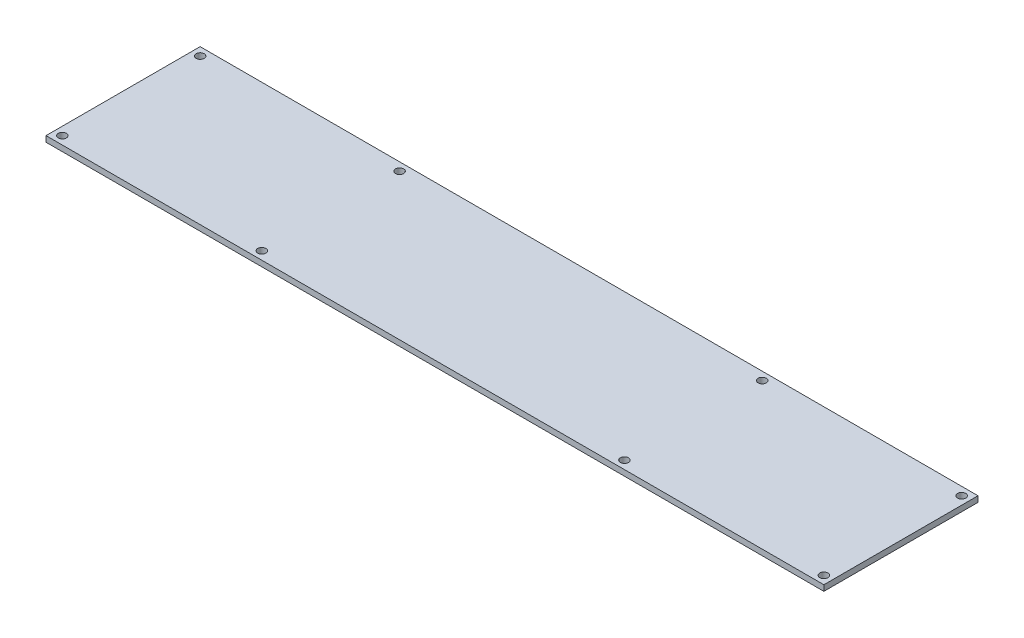
from build123d import *

# Parameters (mm, degrees)
SKETCH1_W            = 429
SKETCH1_H            = 85
BOSS_EXTRUDE1_DEPTH  = 3.175
M4_CLEARANCE_HOLE1_D = 4.5


with BuildPart() as part:
    # Sketch1 → Boss-Extrude1 (new body)
    with BuildSketch(Plane(origin=(0, 0, 0), x_dir=(1, 0, 0), z_dir=(0, 1, 0))):
        Rectangle(SKETCH1_W, SKETCH1_H)
    extrude(amount=BOSS_EXTRUDE1_DEPTH)

    # M4 Clearance Hole1 (through all)
    with Locations(Plane(origin=(0, 3.175, 0), x_dir=(1, 0, 0), z_dir=(0, 1, 0))):
        with Locations((-210, 38), (210, 38), (-100, 38), (100, 38), (100, -38), (-100, -38), (210, -38), (-210, -38)):
            Hole(M4_CLEARANCE_HOLE1_D / 2)


solid = part.part
